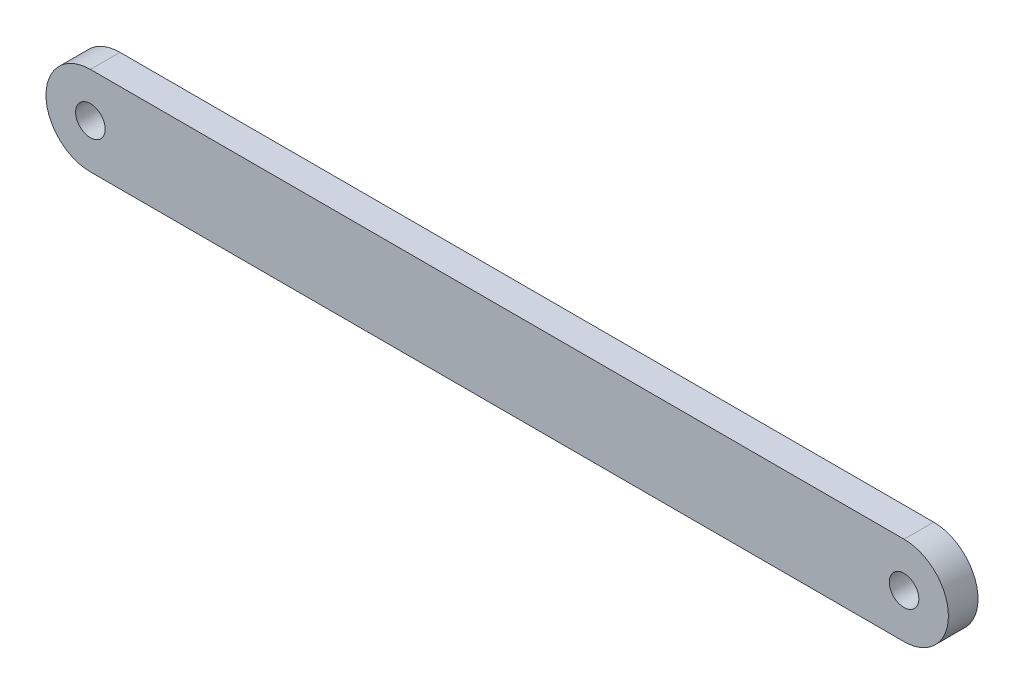
from build123d import *

# Parameters (mm, degrees)
SKETCH_1_R      = 0.5
EXTRUDE_1_DEPTH = 1


with BuildPart() as part:
    # 草图1 → 凸台-拉伸1 (new body)
    with BuildSketch(Plane.XY):
        with BuildLine():
            Line((0, 1.5), (27.5, 1.5))
            ThreePointArc((27.5, 1.5), (29, 0), (27.5, -1.5))
            Line((27.5, -1.5), (0, -1.5))
            ThreePointArc((0, -1.5), (-1.5, 0), (0, 1.5))
        make_face()
        Circle(SKETCH_1_R, mode=Mode.SUBTRACT)
        with Locations((27.5, 0)):
            Circle(SKETCH_1_R, mode=Mode.SUBTRACT)
    extrude(amount=EXTRUDE_1_DEPTH)


solid = part.part
